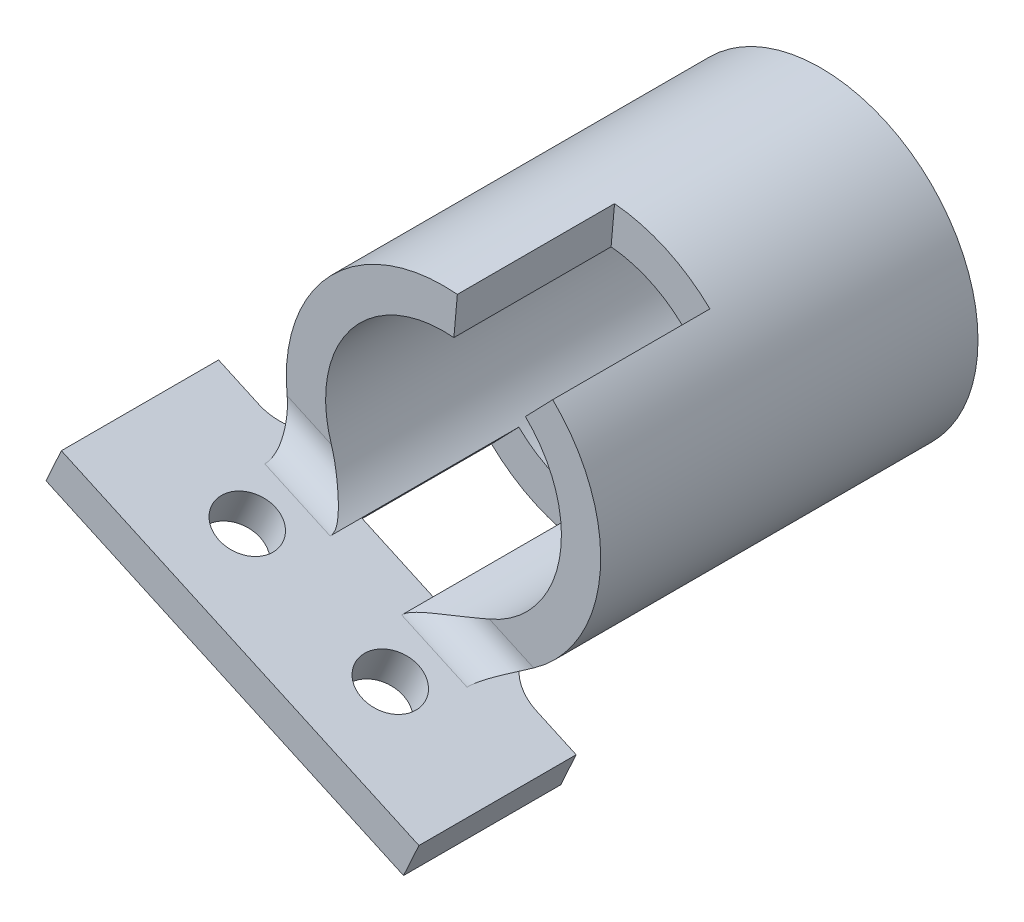
from build123d import *
from build123d.topology import SkipClean

# Parameters (mm, degrees)
SKETCH1_R           = 7.5
SKETCH1_R_2         = 3.285
BOSS_EXTRUDE1_DEPTH = 2
SKETCH1_3_R         = 10
SKETCH1_3_R_2       = 7.5
BOSS_EXTRUDE2_DEPTH = 14
BOSS_EXTRUDE3_DEPTH = 10
BOSS_EXTRUDE4_DEPTH = 10
SKETCH4_R           = 1.8
CUT_EXTRUDE1_DEPTH  = 10
FILLET1_R           = 2
FILLET2_R           = 2


with BuildPart() as part:
    # Sketch1 → Boss-Extrude1 (new body)
    with BuildSketch(Plane.XY):
        Circle(SKETCH1_R)
        Circle(SKETCH1_R_2, mode=Mode.SUBTRACT)
    extrude(amount=BOSS_EXTRUDE1_DEPTH)

    # Sketch1<3> → Boss-Extrude2 (add)
    with BuildSketch(Plane.XY):
        Circle(SKETCH1_3_R)
        Circle(SKETCH1_3_R_2, mode=Mode.SUBTRACT)
    extrude(amount=BOSS_EXTRUDE2_DEPTH)

    # Sketch2 → Boss-Extrude3 (add)
    with SkipClean():  # the faces are left unmerged after this step: merging them gives an invalid solid
        with BuildSketch(Plane.XY.offset(14)):
            with BuildLine():
                ThreePointArc((0.880723614, 9.961140794), (-9.097879067, 4.150734451), (-6.945976325, -7.193984493))
                Line((-6.945976325, -7.193984493), (-5.209482244, -5.39548837))
                ThreePointArc((-5.209482244, -5.39548837), (-6.8234093, 3.113050838), (0.66054271, 7.470855595))
                Line((0.66054271, 7.470855595), (0.880723614, 9.961140794))
            make_face()
            with BuildLine():
                Line((-0.66054271, -7.470855595), (-0.880723614, -9.961140794))
                ThreePointArc((-0.880723614, -9.961140794), (6.752509306, -7.375880833), (10, 0))
                ThreePointArc((10, 0), (9.204883575, 3.907699883), (6.945976325, 7.193984493))
                Line((6.945976325, 7.193984493), (5.209482244, 5.39548837))
                ThreePointArc((5.209482244, 5.39548837), (6.903662681, 2.930774912), (7.5, 0))
                ThreePointArc((7.5, 0), (5.06438198, -5.531910625), (-0.66054271, -7.470855595))
            make_face()
        extrude(amount=BOSS_EXTRUDE3_DEPTH)

    # Sketch3 → Boss-Extrude4 (add)
    with SkipClean():  # the faces are left unmerged after this step: merging them gives an invalid solid
        with BuildSketch(Plane.XY.offset(24)):
            Polygon((8.437336357, -11.621590046), (7.458998865, -13.765980707), (-15.285698803, -3.38914458), (-14.307361311, -1.244753919), align=None)
        extrude(amount=BOSS_EXTRUDE4_DEPTH)

    # Sketch4 → Cut-Extrude1 (cut)
    with SkipClean():  # the faces are left unmerged after this step: merging them gives an invalid solid
        with BuildSketch(Plane(origin=(-3.913349969, -8.577562644, 0), x_dir=(0.9097879067131455, -0.4150734450654641, 0), z_dir=(-0.4150734450654641, -0.9097879067131455, 0))):
            with Locations((-5, 29)):
                Circle(SKETCH4_R)
            with Locations((5, 29)):
                Circle(SKETCH4_R)
        extrude(amount=-CUT_EXTRUDE1_DEPTH, mode=Mode.SUBTRACT)

    # Fillet1
    # the kernel refuses this fillet: 2 mm, written as the material it adds along each edge
    with BuildSketch(Plane(origin=(-5.209482244, -5.39548837, 24), x_dir=(0.415073445065464, 0.9097879067131456, 0), z_dir=(0.9097879067131456, -0.415073445065464, 0))) as fillet1_piece_1_section:
        with BuildLine():
            CenterArc((FILLET1_R, FILLET1_R), FILLET1_R, 180, 90)
            Line((0, FILLET1_R), (0, 0))
            Line((0, 0), (FILLET1_R, 0))
        make_face()
    fillet1_piece_1 = extrude(amount=14.571067812, mode=Mode.PRIVATE)
    fillet1_piece_1 = fillet1_piece_1 & Plane(origin=(0, 0, 24.466684855), x_dir=(-0.08807236135728662, -0.9961140793929938, 0), z_dir=(0, 0, -1)) * Cylinder(10, 38, mode=Mode.PRIVATE)
    fillet1_piece_1 = fillet1_piece_1 - Plane(origin=(0, 0, 24.466684855), x_dir=(0.6945976324993828, 0.7193984493493522, 0), z_dir=(0, 0, -1)) * Cylinder(7.5, 38, mode=Mode.PRIVATE)
    add(fillet1_piece_1)
    with BuildSketch(Plane(origin=(-13.917123993, -1.42279228, 24), x_dir=(0.415073445065464, 0.9097879067131456, 0), z_dir=(0.9097879067131456, -0.415073445065464, 0))) as fillet1_piece_2_section:
        with BuildLine():
            CenterArc((FILLET1_R, FILLET1_R), FILLET1_R, 180, 90)
            Line((0, FILLET1_R), (0, 0))
            Line((0, 0), (FILLET1_R, 0))
        make_face()
    fillet1_piece_2 = extrude(amount=14.571067812, mode=Mode.PRIVATE)
    fillet1_piece_2 = fillet1_piece_2 & Plane(origin=(0, 0, 24.466680249), x_dir=(0.08807236135728662, 0.9961140793929938, 0), z_dir=(0, 0, -1)) * Cylinder(10, 38, mode=Mode.PRIVATE)
    fillet1_piece_2 = fillet1_piece_2 - Plane(origin=(0, 0, 24.466680249), x_dir=(0.6945976324993828, 0.7193984493493522, 0), z_dir=(0, 0, -1)) * Cylinder(7.5, 38, mode=Mode.PRIVATE)
    add(fillet1_piece_2)

    # Fillet2
    # the kernel refuses this fillet: 2 mm, written as the material it adds along each edge
    with BuildSketch(Plane(origin=(0, 0, 24), x_dir=(0.7561376391606037, -0.6544126149797455, 0), z_dir=(0.6544126149797455, 0.7561376391606037, 0))) as fillet2_piece_1_section:
        with BuildLine():
            CenterArc((10 + FILLET2_R, FILLET2_R), FILLET2_R, 180, 90)
            Line((10 + FILLET2_R, 0), (10, 0))
            Line((10, 0), (10, FILLET2_R))
        make_face()
    fillet2_piece_1 = revolve(axis=Axis((0, 0, 24), (0, 0, -1)), revolution_arc=82.826410261, mode=Mode.PRIVATE)
    fillet2_piece_1 = split(fillet2_piece_1, bisect_by=Plane(origin=(2.607194883, -8.96169878, 23.537511389), z_dir=(-0.415073445065464, -0.9097879067131456, 0)), keep=Keep.TOP, mode=Mode.PRIVATE)
    fillet2_piece_1 = split(fillet2_piece_1, bisect_by=Plane(origin=(1.628857391, -11.106089441, 23.537511389), z_dir=(0.41507344506546406, 0.9097879067131456, 0)), keep=Keep.TOP, mode=Mode.PRIVATE)
    add(fillet2_piece_1)
    with BuildSketch(Plane(origin=(0, 0, 24), x_dir=(-0.9898439357335846, 0.1421583022248339, 0), z_dir=(0.1421583022248339, 0.9898439357335846, 0))) as fillet2_piece_2_section:
        with BuildLine():
            CenterArc((10 + FILLET2_R, -FILLET2_R), FILLET2_R, 90, 90)
            Line((10 + FILLET2_R, 0), (10, 0))
            Line((10, 0), (10, -FILLET2_R))
        make_face()
    fillet2_piece_2 = revolve(axis=Axis((0, 0, 24), (0, 0, 1)), revolution_arc=82.826410261, mode=Mode.PRIVATE)
    fillet2_piece_2 = split(fillet2_piece_2, bisect_by=Plane(origin=(-8.477218422, -3.904645831, 23.537511225), z_dir=(-0.415073445065464, -0.9097879067131456, 0)), keep=Keep.TOP, mode=Mode.PRIVATE)
    fillet2_piece_2 = split(fillet2_piece_2, bisect_by=Plane(origin=(-9.455555915, -6.049036492, 23.537511225), z_dir=(0.41507344506546406, 0.9097879067131456, 0)), keep=Keep.TOP, mode=Mode.PRIVATE)
    add(fillet2_piece_2)


solid = part.part
